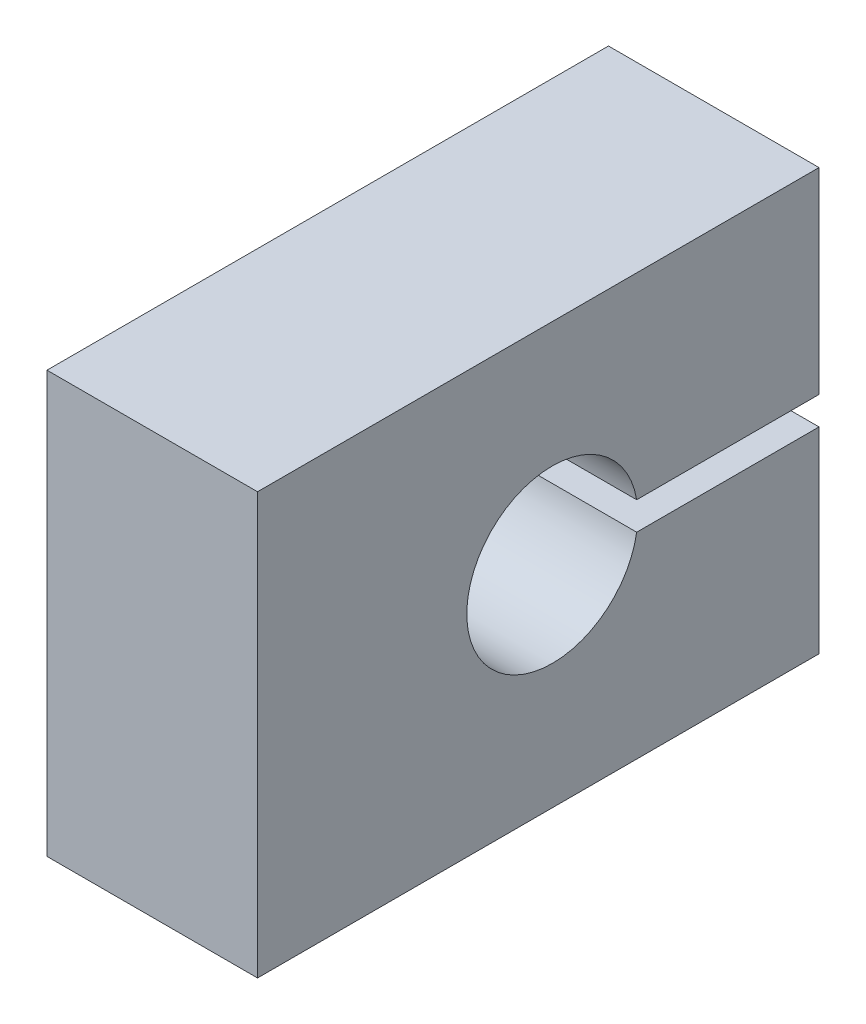
from build123d import *

# Parameters (mm, degrees)
BOSS_EXTRUDE1_DEPTH               = 19.05
F_1_4_20_TAPPED_HOLE1_D           = 5.1054
F_1_4_20_TAPPED_HOLE1_DEPTH       = 16.51
F_1_4_20_TAPPED_HOLE1_CSINK_D     = 6.3754
F_1_4_20_TAPPED_HOLE1_CSINK_ANGLE = 90
F_1_4_20_TAPPED_HOLE1_TIP         = 1.533816902


with BuildPart() as part:
    # Sketch2 → Boss-Extrude1 (new body)
    with BuildSketch(Plane(origin=(0, 0, 0), x_dir=(0, 0, -1), z_dir=(1, 0, 0))):
        with BuildLine():
            Line((0, 0), (50.8, 0))
            Line((50.8, 0), (50.8, 17.78))
            Line((50.8, 17.78), (34.302863934, 17.78))
            ThreePointArc((34.302863934, 17.78), (18.932202392, 19.05), (34.302863934, 20.32))
            Line((34.302863934, 20.32), (50.8, 20.32))
            Line((50.8, 20.32), (50.8, 38.1))
            Line((50.8, 38.1), (0, 38.1))
            Line((0, 38.1), (0, 0))
        make_face()
    extrude(amount=BOSS_EXTRUDE1_DEPTH)

    # 1/4-20 Tapped Hole1
    with Locations(Plane(origin=(0, 0, 0), x_dir=(-1, 0, 0), z_dir=(0, -1, 0))):
        with Locations((-9.525, 12.7), (-9.525, 38.1)):
            CounterSinkHole(F_1_4_20_TAPPED_HOLE1_D / 2, F_1_4_20_TAPPED_HOLE1_CSINK_D / 2, depth=F_1_4_20_TAPPED_HOLE1_DEPTH, counter_sink_angle=F_1_4_20_TAPPED_HOLE1_CSINK_ANGLE)
            with Locations((0, 0, -(F_1_4_20_TAPPED_HOLE1_DEPTH + F_1_4_20_TAPPED_HOLE1_TIP / 2))):  # 118° drill point
                Cone(0, F_1_4_20_TAPPED_HOLE1_D / 2, F_1_4_20_TAPPED_HOLE1_TIP, mode=Mode.SUBTRACT)


solid = part.part
